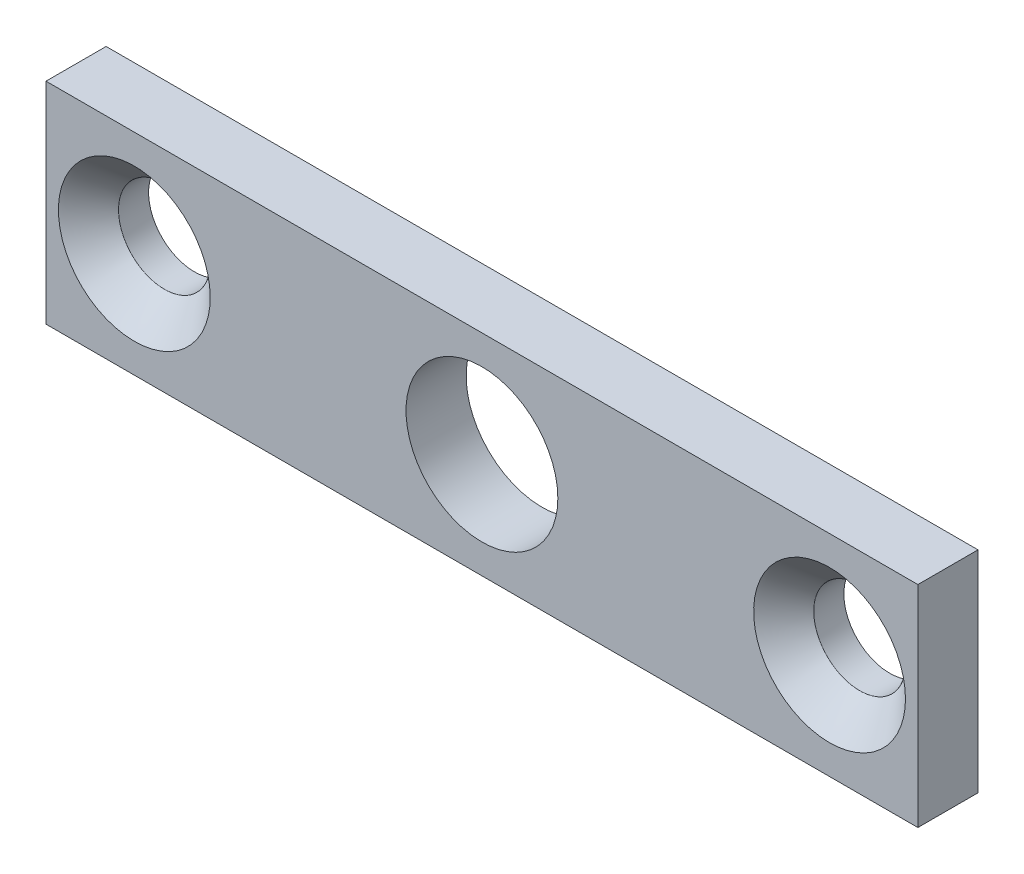
from build123d import *

# Parameters (mm, degrees)
SKETCH_1_W      = 58
SKETCH_1_H      = 14
SKETCH_1_R      = 3.05
SKETCH_1_R_2    = 5.05
EXTRUDE_1_DEPTH = 4
FILLET_1_SIZE   = 2


with BuildPart() as part:
    # 草图1 → 凸台-拉伸1 (new body)
    with BuildSketch(Plane.XY):
        with Locations((23.125, 0)):
            Rectangle(SKETCH_1_W, SKETCH_1_H)
        Circle(SKETCH_1_R, mode=Mode.SUBTRACT)
        with Locations((46.25, 0)):
            Circle(SKETCH_1_R, mode=Mode.SUBTRACT)
        with Locations((23.125, 0)):
            Circle(SKETCH_1_R_2, mode=Mode.SUBTRACT)
    extrude(amount=EXTRUDE_1_DEPTH)

    # 圆角1
    # a fillet whose section is not a circle: 2 mm, written as the material it takes off along each edge
    with BuildSketch(Plane(origin=(0, 0, 4), x_dir=(1, 0, 0), z_dir=(0, -1, 0))) as fillet_1_piece_1:
        with BuildLine():
            Bezier((3.05, -FILLET_1_SIZE), (3.05, 0), (3.05 + FILLET_1_SIZE, 0), weights=[1, 0.014142136, 1])
            Line((3.05 + FILLET_1_SIZE, 0), (3.05, 0))
            Line((3.05, 0), (3.05, -FILLET_1_SIZE))
        make_face()
    revolve(axis=Axis((0, 0, 4), (0, 0, 1)), mode=Mode.SUBTRACT)
    with BuildSketch(Plane(origin=(46.25, 0, 4), x_dir=(1, 0, 0), z_dir=(0, -1, 0))) as fillet_1_piece_2:
        with BuildLine():
            Bezier((3.05, -FILLET_1_SIZE), (3.05, 0), (3.05 + FILLET_1_SIZE, 0), weights=[1, 0.014142136, 1])
            Line((3.05 + FILLET_1_SIZE, 0), (3.05, 0))
            Line((3.05, 0), (3.05, -FILLET_1_SIZE))
        make_face()
    revolve(axis=Axis((46.25, 0, 4), (0, 0, 1)), mode=Mode.SUBTRACT)


solid = part.part
